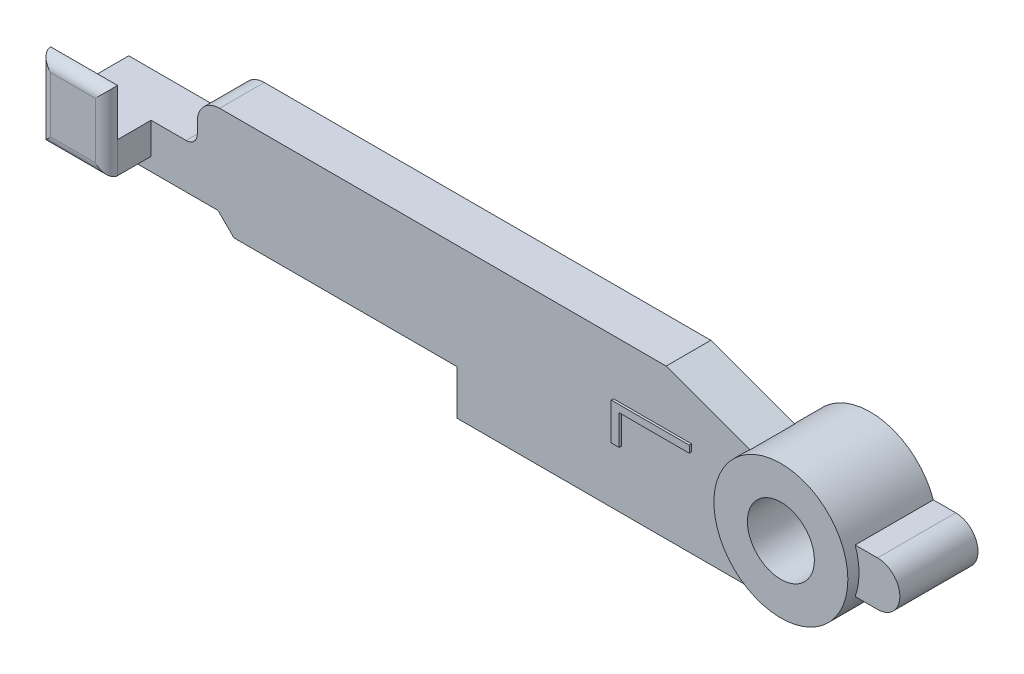
from build123d import *

# Parameters (mm, degrees)
ESTRUSIONE_ESTRUSIONE1_DEPTH             = 2
RACCORDO1_R                              = 1
RACCORDO2_R                              = 0.5
ESTRUSIONE_ESTRUSIONE2_DEPTH             = 2.5
ESTRUSIONE_ESTRUSIONE2_DEPTH_BACK        = 1.5
SCHIZZO2_R                               = 3
ESTRUSIONE_ESTRUSIONE3_REACH             = 20.507
ESTRUSIONE_ESTRUSIONE3_DIRECTION_2_REACH = 20.507
ESTRUSIONE_ESTRUSIONE4_DEPTH             = 3
RACCORDO3_R                              = 0.5
SCHIZZO5_R                               = 1.5
TAGLIO_ESTRUSIONE1_DEPTH                 = 21.528432045
ESTRUSIONE_ESTRUSIONE5_DEPTH             = 0.1


with BuildPart() as part:
    # Schizzo1 → Estrusione-Estrusione1 (new body)
    with BuildSketch(Plane.XY):
        Polygon((-16.707106781, 0.792893219), (-10.707106781, 0.792893219), (-10, 1.5), (0, 1.5), (0, 3.5), (15, 3.5), (15, 0), (15, -1.154985921), (9.361844275, -3.207106781), (-11.638155725, -3.207106781), (-11.638155725, -1.207106781), (-16.707106781, -1.207106781), align=None)
    extrude(amount=ESTRUSIONE_ESTRUSIONE1_DEPTH)

    # Raccordo1
    raccordo1_edges = [part.edges().sort_by_distance(p)[0] for p in [
        (-11.638155725, -3.207106781, 1),
    ]]
    fillet(raccordo1_edges, radius=RACCORDO1_R)

    # Raccordo2
    raccordo2_edges = [part.edges().sort_by_distance(p)[0] for p in [
        (-11.638155725, -1.207106781, 1),
    ]]
    fillet(raccordo2_edges, radius=RACCORDO2_R)

    # Schizzo2 → Estrusione-Estrusione2 (add, two sides: drawn at the far end of the back side and taken through both)
    with BuildSketch(Plane.XY.offset(-ESTRUSIONE_ESTRUSIONE2_DEPTH_BACK)):
        with Locations((15, 0.5)):
            Circle(SCHIZZO2_R)
    extrude(amount=ESTRUSIONE_ESTRUSIONE2_DEPTH + ESTRUSIONE_ESTRUSIONE2_DEPTH_BACK)

    # Estrusione-Estrusione3: up to this face of the body (flat: up to its plane)
    estrusione_estrusione3_end = Plane(part.part.faces().sort_by_distance((0.378494116, -0.204899382, 2))[0])
    # Schizzo3 → Estrusione-Estrusione3 (add, up to the picked face)
    with BuildSketch(Plane.XY, mode=Mode.PRIVATE) as estrusione_estrusione3_sk1:
        with BuildLine():
            Line((18.828427125, 1.5), (17.828427125, 1.5))
            ThreePointArc((17.828427125, 1.5), (18, 0.5), (17.828427125, -0.5))
            Line((17.828427125, -0.5), (18.828427125, -0.5))
            ThreePointArc((18.828427125, -0.5), (19.828427125, 0.5), (18.828427125, 1.5))
        make_face()
    estrusione_estrusione3_tool1 = split(extrude(estrusione_estrusione3_sk1.sketch, amount=ESTRUSIONE_ESTRUSIONE3_REACH, mode=Mode.PRIVATE), bisect_by=estrusione_estrusione3_end, keep=Keep.BOTH, mode=Mode.PRIVATE)
    add(estrusione_estrusione3_tool1.solids().sort_by(Axis((18.792788, 0.5, 0), (0, 0, 1)))[0])

    # Estrusione-Estrusione3 direction 2: up to this face of the body (flat: up to its plane)
    estrusione_estrusione3_direction_2_end = Plane(part.part.faces().sort_by_distance((15, 0.5, -1.5))[0])
    # Schizzo3 → Estrusione-Estrusione3 direction 2 (add, up to the picked face)
    with BuildSketch(Plane.XY, mode=Mode.PRIVATE) as estrusione_estrusione3_direction_2_sk1:
        with BuildLine():
            Line((18.828427125, 1.5), (17.828427125, 1.5))
            ThreePointArc((17.828427125, 1.5), (18, 0.5), (17.828427125, -0.5))
            Line((17.828427125, -0.5), (18.828427125, -0.5))
            ThreePointArc((18.828427125, -0.5), (19.828427125, 0.5), (18.828427125, 1.5))
        make_face()
    estrusione_estrusione3_direction_2_tool1 = split(extrude(estrusione_estrusione3_direction_2_sk1.sketch, amount=-ESTRUSIONE_ESTRUSIONE3_DIRECTION_2_REACH, mode=Mode.PRIVATE), bisect_by=estrusione_estrusione3_direction_2_end, keep=Keep.BOTH, mode=Mode.PRIVATE)
    add(estrusione_estrusione3_direction_2_tool1.solids().sort_by(Axis((18.792788, 0.5, 0), (0, 0, -1)))[0])

    # Schizzo4 → Estrusione-Estrusione4 (add)
    with BuildSketch(Plane.ZY.offset(16.707106781)):
        Polygon((2, -1.207106781), (3.5, -1.207106781), (3.5, -3.307106781), (4, -3.307106781), (4, 0.192893219), (2, 0.192893219), align=None)
    extrude(amount=-ESTRUSIONE_ESTRUSIONE4_DEPTH)

    # Raccordo3
    raccordo3_edges = [part.edges().sort_by_distance(p)[0] for p in [
        (-15.207106781, 0.192893219, 4),
        (-13.707106781, -1.557106781, 4),
        (-15.207106781, -3.307106781, 4),
        (-16.707106781, -1.557106781, 4),
    ]]
    fillet(raccordo3_edges, radius=RACCORDO3_R - 0.0001)  # a hair under: the kernel refuses the full size

    # Schizzo5 → Taglio-Estrusione1 (cut, through all)
    with BuildSketch(Plane.XY.offset(2.5)):
        with Locations((15, 0.5)):
            Circle(SCHIZZO5_R)
    extrude(amount=-TAGLIO_ESTRUSIONE1_DEPTH, mode=Mode.SUBTRACT)


with BuildPart() as body_2:
    # Specchia2: mirrored copy
    add(part.part.mirror(Plane.ZX))

    # Schizzo6 → Estrusione-Estrusione5 (add)
    with BuildSketch(Plane.XY.offset(2)):
        Polygon((10.5, 0.758388832), (10.5, 0.444286268), (7.358974359, 0.444286268), (7.358974359, -0.901867578), (7, -0.901867578), (7, 0.758388832), align=None)
    extrude(amount=ESTRUSIONE_ESTRUSIONE5_DEPTH)


solid = body_2.part
